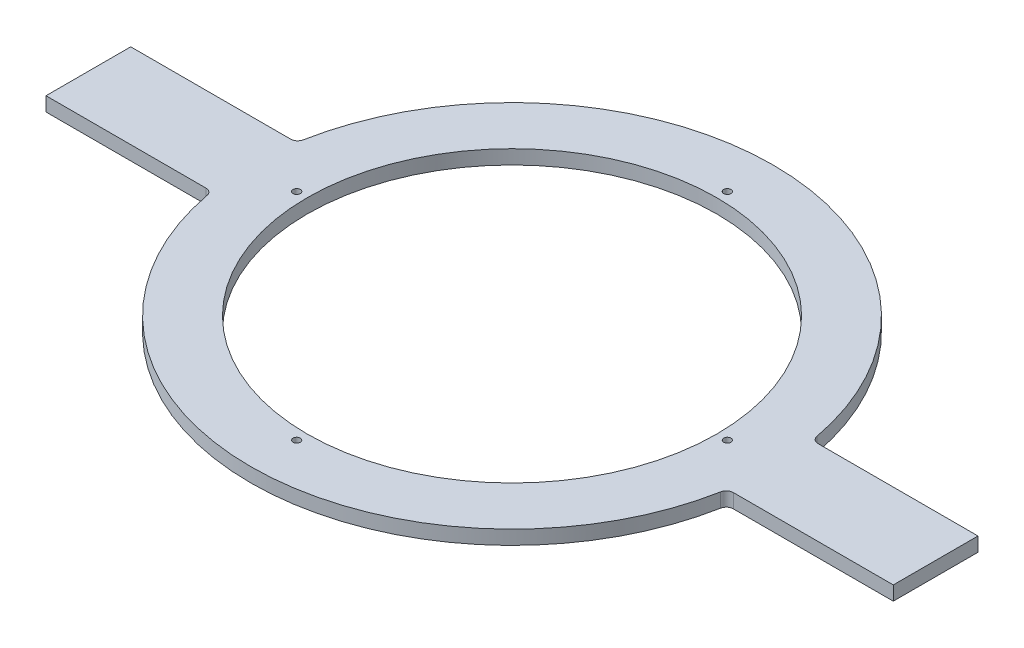
from build123d import *

# Parameters (mm, degrees)
SKETCH1_R             = 92.075
BOSS_EXTRUDE1_DEPTH   = 6.35
FILLET1_R             = 3.175
F_4_CLEARANCE_HOLE1_D = 3.2639


with BuildPart() as part:
    # Sketch1 → Boss-Extrude1 (new body)
    with BuildSketch(Plane(origin=(0, 0, 0), x_dir=(1, 0, 0), z_dir=(0, 1, 0))):
        with BuildLine():
            Line((115.920115273, 19.05), (190.5, 19.05))
            Line((190.5, 19.05), (190.5, -19.05))
            Line((190.5, -19.05), (115.920115273, -19.05))
            ThreePointArc((115.920115273, -19.05), (0, -117.475), (-115.920115273, -19.05))
            Line((-115.920115273, -19.05), (-190.5, -19.05))
            Line((-190.5, -19.05), (-190.5, 19.05))
            Line((-190.5, 19.05), (-115.920115273, 19.05))
            ThreePointArc((-115.920115273, 19.05), (0, 117.475), (115.920115273, 19.05))
        make_face()
        Circle(SKETCH1_R, mode=Mode.SUBTRACT)
    extrude(amount=BOSS_EXTRUDE1_DEPTH)

    # Fillet1
    fillet1_edges = [part.edges().sort_by_distance(p)[0] for p in [
        (-115.920115273, 3.175, -19.05),
        (115.920115273, 3.175, -19.05),
        (115.920115273, 3.175, 19.05),
        (-115.920115273, 3.175, 19.05),
    ]]
    fillet(fillet1_edges, radius=FILLET1_R)

    # #4 Clearance Hole1 (through all)
    with Locations(Plane(origin=(0, 6.35, 0), x_dir=(1, 0, 0), z_dir=(0, 1, 0))):
        with Locations((0, 96.8375), (96.8375, 0), (0, -96.8375), (-96.8375, 0)):
            Hole(F_4_CLEARANCE_HOLE1_D / 2)


solid = part.part
